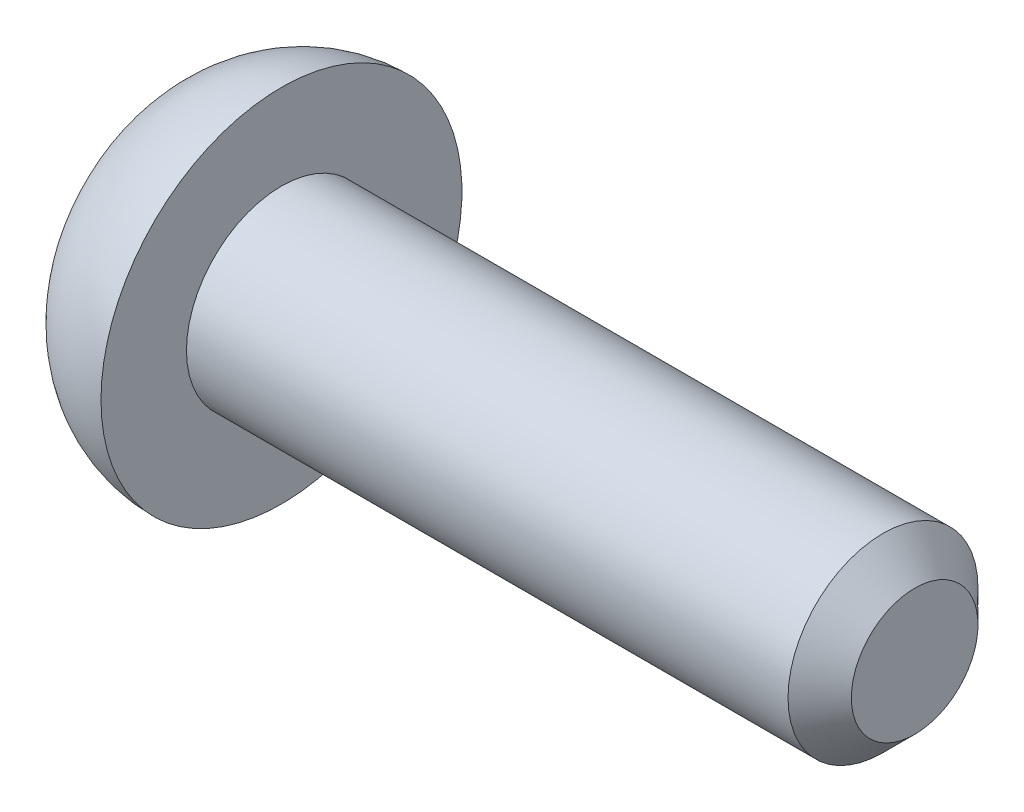
from build123d import *

# Parameters (mm, degrees)
CHAMFER1_SIZE      = 0.5
CUT_EXTRUDE1_DEPTH = 1


with BuildPart() as part:
    # Sketch2 → Revolve1 (revolve)
    with BuildSketch(Plane(origin=(0, 0, 0), x_dir=(1, 0, 0), z_dir=(0, 1, 0))):
        with BuildLine():
            Line((0, 0), (0, 1.5))
            Line((0, 1.5), (-10, 1.5))
            Line((-10, 1.5), (-10, 2.85))
            ThreePointArc((-10, 2.85), (-10.917065968, 2.639177072), (-11.65, 2.049038106))
            Line((-11.65, 2.049038106), (-11.65, 0))
            Line((-11.65, 0), (0, 0))
        make_face()
    revolve(axis=Axis((-11.65, 0, 0), (1, 0, 0)))

    # Chamfer1
    chamfer1_edges = [part.edges().sort_by_distance(p)[0] for p in [
        (0, 0, 1.5),
    ]]
    chamfer(chamfer1_edges, length=CHAMFER1_SIZE)

    # Sketch4 → Cut-Extrude1 (cut)
    with BuildSketch(Plane.ZY.offset(11.65)):
        with BuildLine():
            ThreePointArc((-1.342027284, 0.090739778), (-0.883315009, 0.509982158), (-0.749596595, 1.116859832))
            ThreePointArc((-0.749596595, 1.116859832), (-0.7, 1.212435565), (-0.592430689, 1.20759961))
            ThreePointArc((-0.592430689, 1.20759961), (0, 1.019964317), (0.592430689, 1.20759961))
            ThreePointArc((0.592430689, 1.20759961), (0.7, 1.212435565), (0.749596595, 1.116859832))
            ThreePointArc((0.749596595, 1.116859832), (0.883315009, 0.509982158), (1.342027284, 0.090739778))
            ThreePointArc((1.342027284, 0.090739778), (1.4, 0), (1.342027284, -0.090739778))
            ThreePointArc((1.342027284, -0.090739778), (0.883315009, -0.509982158), (0.749596595, -1.116859832))
            ThreePointArc((0.749596595, -1.116859832), (0.7, -1.212435565), (0.592430689, -1.20759961))
            ThreePointArc((0.592430689, -1.20759961), (0, -1.019964317), (-0.592430689, -1.20759961))
            ThreePointArc((-0.592430689, -1.20759961), (-0.7, -1.212435565), (-0.749596595, -1.116859832))
            ThreePointArc((-0.749596595, -1.116859832), (-0.883315009, -0.509982158), (-1.342027284, -0.090739778))
            ThreePointArc((-1.342027284, -0.090739778), (-1.4, 0), (-1.342027284, 0.090739778))
        make_face()
    extrude(amount=-CUT_EXTRUDE1_DEPTH, mode=Mode.SUBTRACT)


solid = part.part
